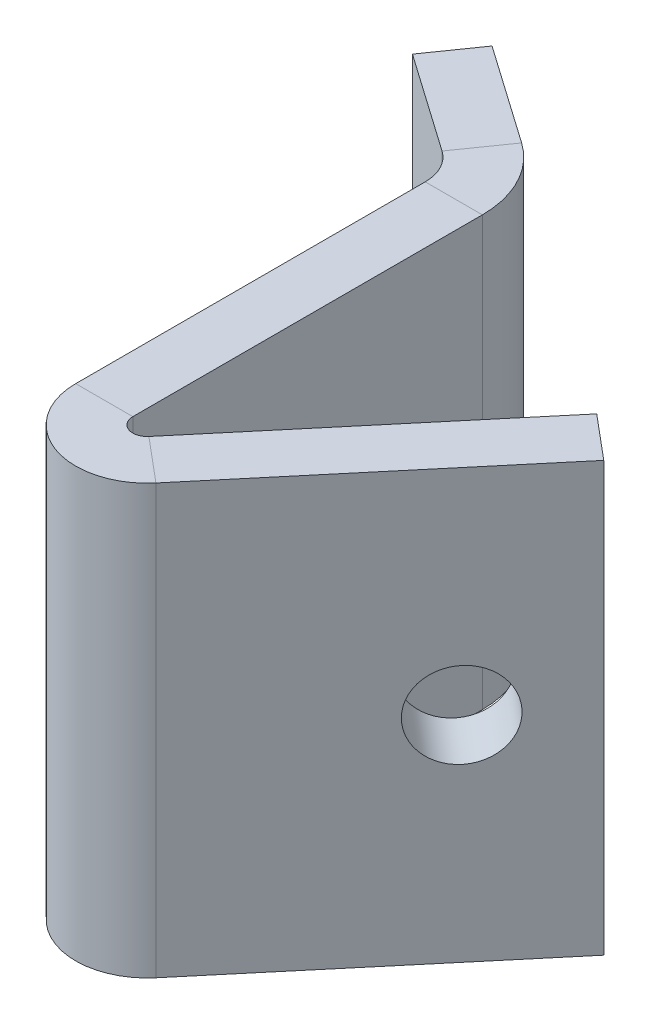
from build123d import *

# Parameters (mm, degrees)
SKETCH_2_W                       = 35
SKETCH_2_H                       = 30
EXTRUDE_1_DEPTH                  = 1
SHEET_START                      = -35
SHEET_METAL_1_OUTLINE_W          = 3
SHEET_METAL_1_OUTLINE_H          = 30
SHEET_METAL_1_DEPTH              = 35
SM_EDGE_FLANGE_1_DEPTH           = 30
SM_EDGE_FLANGE_1_2_DEPTH         = 30
SM_EDGE_FLANGE_2_STRIP_CUT_DEPTH = 30
SM_EDGE_FLANGE_2_DEPTH           = 30
SM_START                         = 4
SM_EDGE_FLANGE_2_PROFILE_W       = 30
SM_EDGE_FLANGE_2_PROFILE_H       = 8.438298848
SM_EDGE_FLANGE_2_PROFILE_R       = 3
SM_EDGE_FLANGE_2_FLAT_DEPTH      = 4
CUT_EXTRUDE_1_REACH              = 58.3
SKETCH_20_R                      = 3
SCALE_1_SCALE                    = 0.3


# Read off the part's stored shape, not the designer's step: 转换实体1, 边线-法兰1
# Sheet-metal steps are written as plain solids
with BuildPart() as part:
    # Sketch 2 → 凸台-拉伸1 (new body)
    with BuildSketch(Plane(origin=(0, 0, 0), x_dir=(0, 0, -1), z_dir=(1, 0, 0))):
        with Locations((17.5, 15)):
            Rectangle(SKETCH_2_W, SKETCH_2_H)
    extrude(amount=EXTRUDE_1_DEPTH)

    # Sheet Metal 1 outline → Sheet Metal 1 (add)
    with BuildSketch(Plane.XY.offset(SHEET_START)):
        with Locations((-1.5, 15)):
            Rectangle(SHEET_METAL_1_OUTLINE_W, SHEET_METAL_1_OUTLINE_H)
    extrude(amount=SHEET_METAL_1_DEPTH)

    # 边线-法兰1 outline → 边线-法兰1 (cut)
    with BuildSketch(Plane(origin=(0, 0, 0), x_dir=(1, 0, 0), z_dir=(0, 1, 0))):
        with BuildLine():
            Line((1, 0), (1, 4.071393241))
            ThreePointArc((1, 4.071393241), (-1.872983346, 5.808095067), (-3, 8.970372727))
            Line((-3, 8.970372727), (-3, 0))
            Line((-3, 0), (1, 0))
        make_face()
    extrude(amount=SM_EDGE_FLANGE_1_DEPTH, mode=Mode.SUBTRACT)

    # Sm Edge Flange 1 2 outline → Sm Edge Flange 1 2 (add)
    with BuildSketch(Plane(origin=(0, 0, 0), x_dir=(1, 0, 0), z_dir=(0, 1, 0))):
        with BuildLine():
            ThreePointArc((1, 4.071393241), (3.646930663, 4.249396197), (5.830222216, 5.756434678))
            Line((5.830222216, 5.756434678), (20.133868015, 22.802855947))
            Line((20.133868015, 22.802855947), (17.069690242, 25.374006385))
            Line((17.069690242, 25.374006385), (2.766044443, 8.327585117))
            ThreePointArc((2.766044443, 8.327585117), (1.657979857, 8.030680106), (1, 8.970372727))
            Line((1, 8.970372727), (1, 4.071393241))
        make_face()
    extrude(amount=SM_EDGE_FLANGE_1_2_DEPTH)

    # 边线-法兰2 strip (across the edge) → 边线-法兰2 strip cut (cut)
    with BuildSketch(Plane(origin=(-3, 30, -35), x_dir=(-0.5735764363510502, 0, 0.8191520442889889), z_dir=(0, -1, 0))):
        Polygon((-19.036380029, 8.446318441), (-1.015035054, -4.172363158), (1.279270691, -0.895754981), (-16.742074283, 11.722926619), align=None)
    extrude(amount=SM_EDGE_FLANGE_2_STRIP_CUT_DEPTH, mode=Mode.SUBTRACT)

    # 边线-法兰2 bend section (across the edge) → 边线-法兰2 (add)
    with BuildSketch(Plane(origin=(-3, 30, -35), x_dir=(-0.5735764363510502, 0, 0.8191520442889889), z_dir=(0, -1, 0))):
        with BuildLine():
            Line((-4, 1.561701152), (0, 1.561701152))
            ThreePointArc((0, 1.561701152), (0.3389675, 0.176455312), (1.279270691, -0.895754981))
            Line((1.279270691, -0.895754981), (-1.015035054, -4.172363158))
            ThreePointArc((-1.015035054, -4.172363158), (-3.209075832, -1.670539141), (-4, 1.561701152))
        make_face()
    extrude(amount=SM_EDGE_FLANGE_2_DEPTH)

    # 边线-法兰2 profile (on flange) → 边线-法兰2 flat (add)
    with BuildSketch(Plane(origin=(-3, 0, -35), x_dir=(0, -1, 0), z_dir=(0.5735764363510502, 0, -0.8191520442889889)).offset(SM_START)):
        with Locations((-15, 5.780850576)):
            Rectangle(SM_EDGE_FLANGE_2_PROFILE_W, SM_EDGE_FLANGE_2_PROFILE_H)
        with Locations((-15, 5)):
            Circle(SM_EDGE_FLANGE_2_PROFILE_R, mode=Mode.SUBTRACT)
    extrude(amount=-SM_EDGE_FLANGE_2_FLAT_DEPTH)

    # 草图20 → 切除-拉伸1 (cut, up to next)
    with BuildSketch(Plane(origin=(-2.477353684, 0, -2.078746562), x_dir=(-0.6427876096865404, 0, 0.7660444431189772), z_dir=(-0.7660444431189772, 0, -0.6427876096865404)), mode=Mode.PRIVATE) as cut_extrude_1_sk1:
        with Locations((-23.351124779, 15)):
            Circle(SKETCH_20_R)
    cut_extrude_1_tool1 = extrude(cut_extrude_1_sk1.sketch, amount=-CUT_EXTRUDE_1_REACH, mode=Mode.PRIVATE) & part.part
    add(cut_extrude_1_tool1.solids().sort_by_distance((12.53246, 15, -19.966746))[0], mode=Mode.SUBTRACT)


with BuildPart() as part_1:
    # 缩放比例1: scaled about (2.566692586, 15, -20.896699523)
    add(part.part.scale(SCALE_1_SCALE).moved(Location((1.79668481, 10.5, -14.627689666))))


solid = part_1.part
